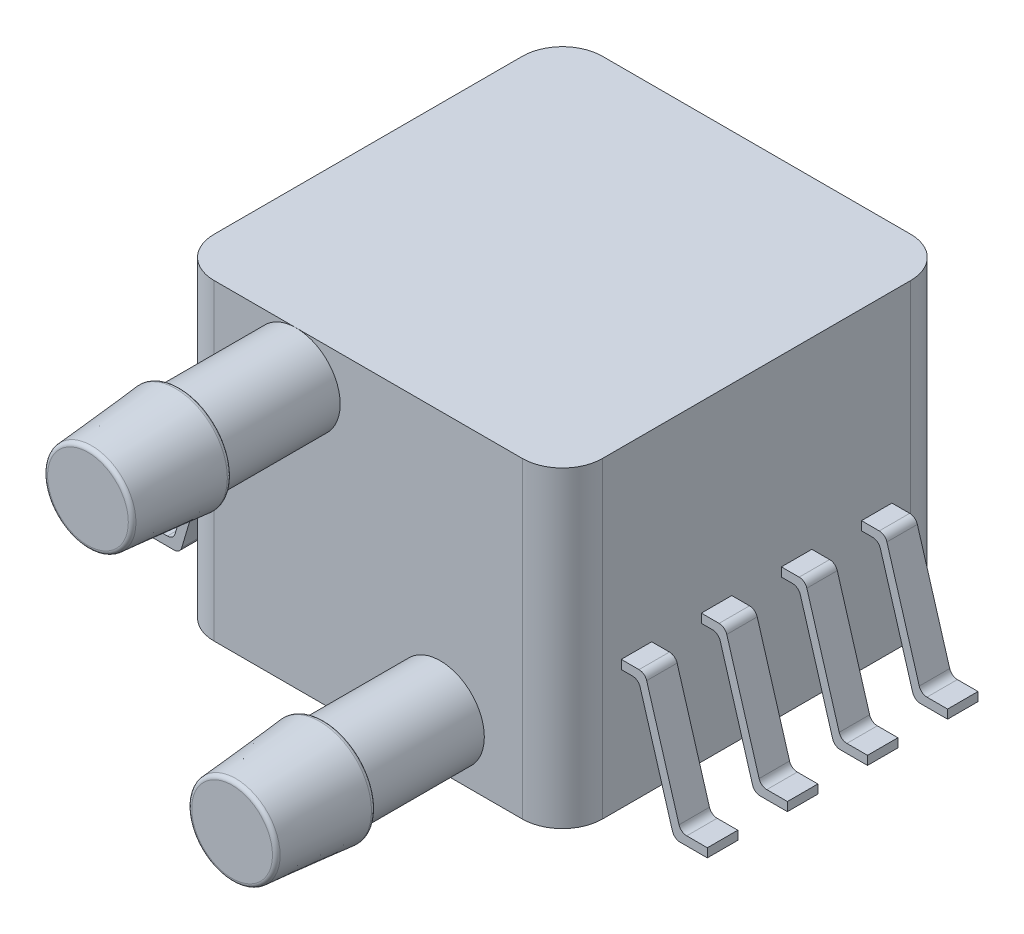
from build123d import *

# Parameters (mm, degrees)
SKETCH1_W              = 12.319
SKETCH1_H              = 12.319
BOSS_EXTRUDE1_DEPTH    = 9.906
FILLET1_R              = 0.127
FILLET2_R              = 1.27
LPATTERN2_COUNT        = 2
LPATTERN2_PITCH        = 4.572
LPATTERN2_COUNT_DIR2   = 2
LPATTERN2_PITCH_DIR2   = 6.858
FILLET1_OF_LPATTERN2_R = 0.127
BOSS_EXTRUDE2_DEPTH    = 0.4826
FILLET3_R              = 0.254
LPATTERN5_COUNT        = 4
LPATTERN5_PITCH        = 2.54
FILLET3_OF_LPATTERN5_R = 0.254
MIRROR1_START          = -4.2926
MIRROR1_DEPTH          = 0.9652
MIRROR1_START_2        = -1.7526
MIRROR1_2_DEPTH        = 0.9652
MIRROR1_START_3        = 0.7874
MIRROR1_3_DEPTH        = 0.9652
MIRROR1_START_4        = 3.3274
MIRROR1_4_DEPTH        = 0.9652


# Read off the part's stored shape, not the designer's step: Mirror1
with BuildPart() as part:
    # Sketch1 → Boss-Extrude1 (new body)
    with BuildSketch(Plane(origin=(0, 0, 0), x_dir=(1, 0, 0), z_dir=(0, 1, 0))):
        Rectangle(SKETCH1_W, SKETCH1_H)
    extrude(amount=BOSS_EXTRUDE1_DEPTH)

    # Sketch3 → Revolve1 (revolve)
    with BuildSketch(Plane.XZ.offset(-8.509), mode=Mode.PRIVATE) as revolve1_sk:
        Polygon((-3.683, 6.1595), (-3.683, 9.8425), (-3.937, 9.8425), (-3.683, 12.7635), (-2.286, 12.7635), (-2.286, 6.1595), align=None)
    revolve1 = revolve(revolve1_sk.sketch.rotate(Axis((-2.286, 8.509, 12.7635), (0, 0, -1)), 180), axis=Axis((-2.286, 8.509, 12.7635), (0, 0, -1)))

    # Fillet1
    fillet1_edges = [part.edges().sort_by_distance(p)[0] for p in [
        (-3.937, 8.509, 9.8425),
        (-3.683, 8.509, 12.7635),
    ]]
    fillet(fillet1_edges, radius=FILLET1_R)

    # Fillet2
    fillet2_edges = [part.edges().sort_by_distance(p)[0] for p in [
        (6.1595, 4.953, 6.1595),
        (-6.1595, 4.953, 6.1595),
        (-6.1595, 4.953, -6.1595),
        (6.1595, 4.953, -6.1595),
    ]]
    fillet(fillet2_edges, radius=FILLET2_R)

    # LPattern2: Revolve1 2 × 2, 2 skipped
    with Locations(*[(i * LPATTERN2_PITCH, -j * LPATTERN2_PITCH_DIR2, 0) for i in range(LPATTERN2_COUNT) for j in range(LPATTERN2_COUNT_DIR2) if (i, j) not in ((0, 0), (0, 1), (1, 0))]):
        add(revolve1)

    # Fillet1 of LPattern2
    fillet1_of_lpattern2_edges = [part.edges().sort_by_distance(p)[0] for p in [
        (0.635, 1.651, 9.8425),
        (0.889, 1.651, 12.7635),
    ]]
    fillet(fillet1_of_lpattern2_edges, radius=FILLET1_OF_LPATTERN2_R)

    # Sketch5 → Boss-Extrude2 (add, symmetric)
    with BuildSketch(Plane(origin=(0, 0, 3.81), x_dir=(0, -1, 0), z_dir=(0, 0, 1))):
        Polygon((-3.81, 6.1595), (-3.81, 6.70408255), (0, 7.837886271), (0, 8.89), (-0.2794, 8.89), (-0.2794, 8.046249759), (-4.0894, 6.912446038), (-4.0894, 6.1595), align=None)
    boss_extrude2 = extrude(amount=BOSS_EXTRUDE2_DEPTH, both=True)

    # Fillet3
    fillet3_edges = [part.edges().sort_by_distance(p)[0] for p in [
        (6.70408255, 3.81, 3.81),
        (7.837886271, 0, 3.81),
        (8.046249759, 0.2794, 3.81),
        (6.912446038, 4.0894, 3.81),
    ]]
    fillet(fillet3_edges, radius=FILLET3_R)

    # LPattern5: Boss-Extrude2 ×4
    with Locations(*[(0, 0, -i * LPATTERN5_PITCH) for i in range(1, LPATTERN5_COUNT)]):
        add(boss_extrude2)

    # Fillet3 of LPattern5
    fillet3_of_lpattern5_edges = [part.edges().sort_by_distance(p)[0] for p in [
        (6.70408255, 3.81, 1.27),
        (7.837886271, 0, 1.27),
        (8.046249759, 0.2794, 1.27),
        (6.912446038, 4.0894, 1.27),
        (6.70408255, 3.81, -1.27),
        (7.837886271, 0, -1.27),
        (8.046249759, 0.2794, -1.27),
        (6.912446038, 4.0894, -1.27),
        (6.70408255, 3.81, -3.81),
        (7.837886271, 0, -3.81),
        (8.046249759, 0.2794, -3.81),
        (6.912446038, 4.0894, -3.81),
    ]]
    fillet(fillet3_of_lpattern5_edges, radius=FILLET3_OF_LPATTERN5_R)

    # Mirror1 outline → Mirror1 (add)
    with BuildSketch(Plane.XY.offset(MIRROR1_START)):
        with BuildLine():
            Line((-8.89, 0.2794), (-8.89, 0))
            Line((-8.89, 0), (-8.027307623, 0))
            ThreePointArc((-8.027307623, 0), (-7.875461582, 0.050385708), (-7.783858614, 0.181552915))
            Line((-7.783858614, 0.181552915), (-6.758110207, 3.628447085))
            ThreePointArc((-6.758110207, 3.628447085), (-6.666507239, 3.759614292), (-6.514661198, 3.81))
            Line((-6.514661198, 3.81), (-6.1595, 3.81))
            Line((-6.1595, 3.81), (-6.1595, 4.0894))
            Line((-6.1595, 4.0894), (-6.723024685, 4.0894))
            ThreePointArc((-6.723024685, 4.0894), (-6.874870727, 4.039014292), (-6.966473694, 3.907847085))
            Line((-6.966473694, 3.907847085), (-7.992222102, 0.460952915))
            ThreePointArc((-7.992222102, 0.460952915), (-8.08382507, 0.329785708), (-8.235671111, 0.2794))
            Line((-8.235671111, 0.2794), (-8.89, 0.2794))
        make_face()
    extrude(amount=MIRROR1_DEPTH)

    # Mirror1 2 outline → Mirror1 2 (add)
    with BuildSketch(Plane.XY.offset(MIRROR1_START_2)):
        with BuildLine():
            Line((-8.89, 0.2794), (-8.89, 0))
            Line((-8.89, 0), (-8.027307623, 0))
            ThreePointArc((-8.027307623, 0), (-7.875461582, 0.050385708), (-7.783858614, 0.181552915))
            Line((-7.783858614, 0.181552915), (-6.758110207, 3.628447085))
            ThreePointArc((-6.758110207, 3.628447085), (-6.666507239, 3.759614292), (-6.514661198, 3.81))
            Line((-6.514661198, 3.81), (-6.1595, 3.81))
            Line((-6.1595, 3.81), (-6.1595, 4.0894))
            Line((-6.1595, 4.0894), (-6.723024685, 4.0894))
            ThreePointArc((-6.723024685, 4.0894), (-6.874870727, 4.039014292), (-6.966473694, 3.907847085))
            Line((-6.966473694, 3.907847085), (-7.992222102, 0.460952915))
            ThreePointArc((-7.992222102, 0.460952915), (-8.08382507, 0.329785708), (-8.235671111, 0.2794))
            Line((-8.235671111, 0.2794), (-8.89, 0.2794))
        make_face()
    extrude(amount=MIRROR1_2_DEPTH)

    # Mirror1 3 outline → Mirror1 3 (add)
    with BuildSketch(Plane.XY.offset(MIRROR1_START_3)):
        with BuildLine():
            Line((-8.89, 0.2794), (-8.89, 0))
            Line((-8.89, 0), (-8.027307623, 0))
            ThreePointArc((-8.027307623, 0), (-7.875461582, 0.050385708), (-7.783858614, 0.181552915))
            Line((-7.783858614, 0.181552915), (-6.758110207, 3.628447085))
            ThreePointArc((-6.758110207, 3.628447085), (-6.666507239, 3.759614292), (-6.514661198, 3.81))
            Line((-6.514661198, 3.81), (-6.1595, 3.81))
            Line((-6.1595, 3.81), (-6.1595, 4.0894))
            Line((-6.1595, 4.0894), (-6.723024685, 4.0894))
            ThreePointArc((-6.723024685, 4.0894), (-6.874870727, 4.039014292), (-6.966473694, 3.907847085))
            Line((-6.966473694, 3.907847085), (-7.992222102, 0.460952915))
            ThreePointArc((-7.992222102, 0.460952915), (-8.08382507, 0.329785708), (-8.235671111, 0.2794))
            Line((-8.235671111, 0.2794), (-8.89, 0.2794))
        make_face()
    extrude(amount=MIRROR1_3_DEPTH)

    # Mirror1 4 outline → Mirror1 4 (add)
    with BuildSketch(Plane.XY.offset(MIRROR1_START_4)):
        with BuildLine():
            Line((-8.89, 0.2794), (-8.89, 0))
            Line((-8.89, 0), (-8.027307623, 0))
            ThreePointArc((-8.027307623, 0), (-7.875461582, 0.050385708), (-7.783858614, 0.181552915))
            Line((-7.783858614, 0.181552915), (-6.758110207, 3.628447085))
            ThreePointArc((-6.758110207, 3.628447085), (-6.666507239, 3.759614292), (-6.514661198, 3.81))
            Line((-6.514661198, 3.81), (-6.1595, 3.81))
            Line((-6.1595, 3.81), (-6.1595, 4.0894))
            Line((-6.1595, 4.0894), (-6.723024685, 4.0894))
            ThreePointArc((-6.723024685, 4.0894), (-6.874870727, 4.039014292), (-6.966473694, 3.907847085))
            Line((-6.966473694, 3.907847085), (-7.992222102, 0.460952915))
            ThreePointArc((-7.992222102, 0.460952915), (-8.08382507, 0.329785708), (-8.235671111, 0.2794))
            Line((-8.235671111, 0.2794), (-8.89, 0.2794))
        make_face()
    extrude(amount=MIRROR1_4_DEPTH)


solid = part.part
